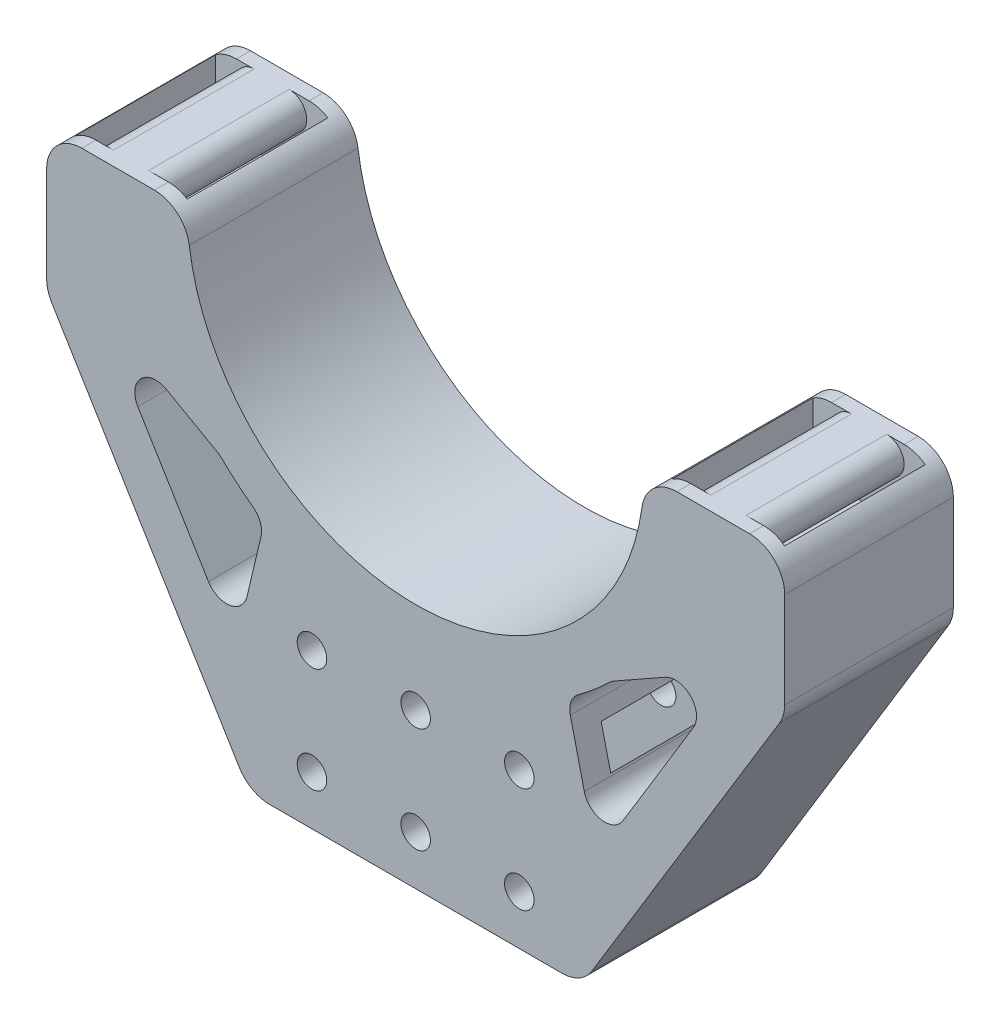
from build123d import *

# Parameters (mm, degrees)
BOSS_EXTRUDE1_DEPTH   = 12.7
BOSS_EXTRUDE1_2_DEPTH = 12.7
BOSS_EXTRUDE1_3_DEPTH = 12.7
BOSS_EXTRUDE3_START   = 15.24
BOSS_EXTRUDE3_DEPTH   = 2.54
BOSS_EXTRUDE4_START   = -12.7
BOSS_EXTRUDE4_DEPTH   = 2.54
FILLET2_R             = 6.35
SKETCH2_W             = 60.761999888
SKETCH2_H             = 20.761999878
CUT_EXTRUDE1_DEPTH    = 38.1
SKETCH3_R             = 2.667
CUT_EXTRUDE2_DEPTH    = 113.791124208
CUT_EXTRUDE3_DEPTH    = 113.791124208
FILLET3_R             = 3.81


with BuildPart() as part:
    # Sketch1 → Boss-Extrude1 (new, symmetric)
    with BuildSketch(Plane.XY):
        with BuildLine():
            ThreePointArc((41.27, 0), (0, -41.27), (-41.27, 0))
            Line((-41.27, 0), (-43.81, 0))
            Line((-43.81, 0), (-43.81, -9.650754782))
            ThreePointArc((-43.81, -9.650754782), (-46.984221818, -11.904467031), (-50.795, -12.7))
            Line((-50.795, -12.7), (-57.145, -12.7))
            ThreePointArc((-57.145, -12.7), (-60.955778182, -11.904467031), (-64.13, -9.650754782))
            Line((-64.13, -9.650754782), (-64.13, 0))
            Line((-64.13, 0), (-66.67, 0))
            Line((-66.67, 0), (-66.67, -25.4))
            Line((-66.67, -25.4), (-30, -85.72))
            Line((-30, -85.72), (30, -85.72))
            Line((30, -85.72), (66.67, -25.4))
            Line((66.67, -25.4), (66.67, 0))
            Line((66.67, 0), (64.13, 0))
            Line((64.13, 0), (64.13, -9.650754782))
            ThreePointArc((64.13, -9.650754782), (60.955778182, -11.904467031), (57.145, -12.7))
            Line((57.145, -12.7), (50.795, -12.7))
            ThreePointArc((50.795, -12.7), (46.984221818, -11.904467031), (43.81, -9.650754782))
            Line((43.81, -9.650754782), (43.81, 0))
            Line((43.81, 0), (41.27, 0))
        make_face()
    extrude(amount=BOSS_EXTRUDE1_DEPTH, both=True)



with BuildPart() as body_2:
    # Sketch1 → Boss-Extrude1 2 (new, symmetric)
    with BuildSketch(Plane.XY):
        with BuildLine():
            ThreePointArc((-50.795, -6.35), (-47.62, -3.175), (-50.795, 0))
            Line((-50.795, 0), (-57.145, 0))
            ThreePointArc((-57.145, 0), (-60.32, -3.175), (-57.145, -6.35))
            Line((-57.145, -6.35), (-50.795, -6.35))
        make_face()
    extrude(amount=BOSS_EXTRUDE1_2_DEPTH, both=True)


with BuildPart() as body_3:
    # Sketch1 → Boss-Extrude1 3 (new, symmetric)
    with BuildSketch(Plane.XY):
        with BuildLine():
            Line((57.145, 0), (50.795, 0))
            ThreePointArc((50.795, 0), (47.62, -3.175), (50.795, -6.35))
            Line((50.795, -6.35), (57.145, -6.35))
            ThreePointArc((57.145, -6.35), (60.32, -3.175), (57.145, 0))
        make_face()
    extrude(amount=BOSS_EXTRUDE1_3_DEPTH, both=True)


with BuildPart() as part_1:
    add(part.part)

    add(body_2.part)  # Boss-Extrude3 merges body 2

    add(body_3.part)  # Boss-Extrude3 merges body 3
    # Sketch1<3> → Boss-Extrude3 (add)
    with BuildSketch(Plane.XY.offset(BOSS_EXTRUDE3_START)):
        with BuildLine():
            ThreePointArc((41.27, 0), (0, -41.27), (-41.27, 0))
            Line((-41.27, 0), (-43.81, 0))
            Line((-43.81, 0), (-43.81, -9.650754782))
            ThreePointArc((-43.81, -9.650754782), (-46.984221818, -11.904467031), (-50.795, -12.7))
            Line((-50.795, -12.7), (-57.145, -12.7))
            ThreePointArc((-57.145, -12.7), (-60.955778182, -11.904467031), (-64.13, -9.650754782))
            Line((-64.13, -9.650754782), (-64.13, 0))
            Line((-64.13, 0), (-66.67, 0))
            Line((-66.67, 0), (-66.67, -25.4))
            Line((-66.67, -25.4), (-30, -85.72))
            Line((-30, -85.72), (30, -85.72))
            Line((30, -85.72), (66.67, -25.4))
            Line((66.67, -25.4), (66.67, 0))
            Line((66.67, 0), (64.13, 0))
            Line((64.13, 0), (64.13, -9.650754782))
            ThreePointArc((64.13, -9.650754782), (60.955778182, -11.904467031), (57.145, -12.7))
            Line((57.145, -12.7), (50.795, -12.7))
            ThreePointArc((50.795, -12.7), (46.984221818, -11.904467031), (43.81, -9.650754782))
            Line((43.81, -9.650754782), (43.81, 0))
            Line((43.81, 0), (41.27, 0))
        make_face()
        with BuildLine():
            Line((-43.81, -9.650754782), (-43.81, 0))
            Line((-43.81, 0), (-50.795, 0))
            ThreePointArc((-50.795, 0), (-47.62, -3.175), (-50.795, -6.35))
            Line((-50.795, -6.35), (-57.145, -6.35))
            ThreePointArc((-57.145, -6.35), (-60.32, -3.175), (-57.145, 0))
            Line((-57.145, 0), (-64.13, 0))
            Line((-64.13, 0), (-64.13, -9.650754782))
            ThreePointArc((-64.13, -9.650754782), (-60.955778182, -11.904467031), (-57.145, -12.7))
            Line((-57.145, -12.7), (-50.795, -12.7))
            ThreePointArc((-50.795, -12.7), (-46.984221818, -11.904467031), (-43.81, -9.650754782))
        make_face()
        with BuildLine():
            ThreePointArc((-50.795, -6.35), (-47.62, -3.175), (-50.795, 0))
            Line((-50.795, 0), (-57.145, 0))
            ThreePointArc((-57.145, 0), (-60.32, -3.175), (-57.145, -6.35))
            Line((-57.145, -6.35), (-50.795, -6.35))
        make_face()
        with BuildLine():
            Line((50.795, 0), (43.81, 0))
            Line((43.81, 0), (43.81, -9.650754782))
            ThreePointArc((43.81, -9.650754782), (46.984221818, -11.904467031), (50.795, -12.7))
            Line((50.795, -12.7), (57.145, -12.7))
            ThreePointArc((57.145, -12.7), (60.955778182, -11.904467031), (64.13, -9.650754782))
            Line((64.13, -9.650754782), (64.13, 0))
            Line((64.13, 0), (57.145, 0))
            ThreePointArc((57.145, 0), (60.32, -3.175), (57.145, -6.35))
            Line((57.145, -6.35), (50.795, -6.35))
            ThreePointArc((50.795, -6.35), (47.62, -3.175), (50.795, 0))
        make_face()
        with BuildLine():
            Line((57.145, 0), (50.795, 0))
            ThreePointArc((50.795, 0), (47.62, -3.175), (50.795, -6.35))
            Line((50.795, -6.35), (57.145, -6.35))
            ThreePointArc((57.145, -6.35), (60.32, -3.175), (57.145, 0))
        make_face()
    extrude(amount=-BOSS_EXTRUDE3_DEPTH)

    # Sketch1<4> → Boss-Extrude4 (add)
    with BuildSketch(Plane.XY.offset(BOSS_EXTRUDE4_START)):
        with BuildLine():
            ThreePointArc((-50.795, -6.35), (-47.62, -3.175), (-50.795, 0))
            Line((-50.795, 0), (-57.145, 0))
            ThreePointArc((-57.145, 0), (-60.32, -3.175), (-57.145, -6.35))
            Line((-57.145, -6.35), (-50.795, -6.35))
        make_face()
        with BuildLine():
            Line((-43.81, -9.650754782), (-43.81, 0))
            Line((-43.81, 0), (-50.795, 0))
            ThreePointArc((-50.795, 0), (-47.62, -3.175), (-50.795, -6.35))
            Line((-50.795, -6.35), (-57.145, -6.35))
            ThreePointArc((-57.145, -6.35), (-60.32, -3.175), (-57.145, 0))
            Line((-57.145, 0), (-64.13, 0))
            Line((-64.13, 0), (-64.13, -9.650754782))
            ThreePointArc((-64.13, -9.650754782), (-60.955778182, -11.904467031), (-57.145, -12.7))
            Line((-57.145, -12.7), (-50.795, -12.7))
            ThreePointArc((-50.795, -12.7), (-46.984221818, -11.904467031), (-43.81, -9.650754782))
        make_face()
        with BuildLine():
            ThreePointArc((41.27, 0), (0, -41.27), (-41.27, 0))
            Line((-41.27, 0), (-43.81, 0))
            Line((-43.81, 0), (-43.81, -9.650754782))
            ThreePointArc((-43.81, -9.650754782), (-46.984221818, -11.904467031), (-50.795, -12.7))
            Line((-50.795, -12.7), (-57.145, -12.7))
            ThreePointArc((-57.145, -12.7), (-60.955778182, -11.904467031), (-64.13, -9.650754782))
            Line((-64.13, -9.650754782), (-64.13, 0))
            Line((-64.13, 0), (-66.67, 0))
            Line((-66.67, 0), (-66.67, -25.4))
            Line((-66.67, -25.4), (-30, -85.72))
            Line((-30, -85.72), (30, -85.72))
            Line((30, -85.72), (66.67, -25.4))
            Line((66.67, -25.4), (66.67, 0))
            Line((66.67, 0), (64.13, 0))
            Line((64.13, 0), (64.13, -9.650754782))
            ThreePointArc((64.13, -9.650754782), (60.955778182, -11.904467031), (57.145, -12.7))
            Line((57.145, -12.7), (50.795, -12.7))
            ThreePointArc((50.795, -12.7), (46.984221818, -11.904467031), (43.81, -9.650754782))
            Line((43.81, -9.650754782), (43.81, 0))
            Line((43.81, 0), (41.27, 0))
        make_face()
        with BuildLine():
            Line((57.145, 0), (50.795, 0))
            ThreePointArc((50.795, 0), (47.62, -3.175), (50.795, -6.35))
            Line((50.795, -6.35), (57.145, -6.35))
            ThreePointArc((57.145, -6.35), (60.32, -3.175), (57.145, 0))
        make_face()
        with BuildLine():
            Line((50.795, 0), (43.81, 0))
            Line((43.81, 0), (43.81, -9.650754782))
            ThreePointArc((43.81, -9.650754782), (46.984221818, -11.904467031), (50.795, -12.7))
            Line((50.795, -12.7), (57.145, -12.7))
            ThreePointArc((57.145, -12.7), (60.955778182, -11.904467031), (64.13, -9.650754782))
            Line((64.13, -9.650754782), (64.13, 0))
            Line((64.13, 0), (57.145, 0))
            ThreePointArc((57.145, 0), (60.32, -3.175), (57.145, -6.35))
            Line((57.145, -6.35), (50.795, -6.35))
            ThreePointArc((50.795, -6.35), (47.62, -3.175), (50.795, 0))
        make_face()
    extrude(amount=-BOSS_EXTRUDE4_DEPTH)

    # Fillet2
    # the kernel refuses this fillet: 6.35 mm, written as the material it takes off along each edge
    with BuildSketch(Plane(origin=(-66.67, 0, -31.115), x_dir=(1, 0, 0), z_dir=(0, 0, 1))) as fillet2_piece_1:
        with BuildLine():
            CenterArc((FILLET2_R, -FILLET2_R), FILLET2_R, 90, 90)
            Line((0, -FILLET2_R), (0, 0))
            Line((0, 0), (FILLET2_R, 0))
        make_face()
    extrude(amount=62.23, mode=Mode.SUBTRACT)
    with BuildSketch(Plane(origin=(-41.27, 0, -30.051808055), x_dir=(0.06682302644144887, -0.9977648436065512, 0), z_dir=(0, 0, 1)), Plane(origin=(41.27, 0, 30.051808055), x_dir=(-0.06682302644145022, -0.9977648436065509, 0), z_dir=(0, 0, -1))) as fillet2_piece_2:
        with BuildLine():
            CenterArc((5.93989882, -6.335806757), FILLET2_R, 93.831532506, 82.336934987)
            Line((-0.395907937, -5.911480539), (0, 0))
            ThreePointArc((0, 0), (2.757786301, -0.092244904), (5.515572602, 0))
        make_face()
    extrude(amount=60.10361611, mode=Mode.SUBTRACT)
    with BuildSketch(Plane(origin=(66.67, 0, 31.115), x_dir=(0, -1, 0), z_dir=(0, 0, -1))) as fillet2_piece_3:
        with BuildLine():
            CenterArc((FILLET2_R, FILLET2_R), FILLET2_R, 180, 90)
            Line((0, FILLET2_R), (0, 0))
            Line((0, 0), (FILLET2_R, 0))
        make_face()
    extrude(amount=62.23, mode=Mode.SUBTRACT)
    with BuildSketch(Plane(origin=(66.67, -25.4, -19.686784737), x_dir=(-0.5194660032089745, -0.8544911184500947, 0), z_dir=(0, 0, 1)), Plane(origin=(-66.67, -25.4, -19.686784737), x_dir=(0, 1, 0), z_dir=(0, 0, 1))) as fillet2_piece_4:
        with BuildLine():
            CenterArc((FILLET2_R * 0.280112424395, -FILLET2_R), FILLET2_R, 90, 31.296438863)
            Line((-FILLET2_R * 0.239353578813, -FILLET2_R * 0.14550888155), (0, 0))
            Line((0, 0), (FILLET2_R * 0.280112424395, 0))
        make_face()
    extrude(amount=39.373569475, mode=Mode.SUBTRACT)
    with BuildSketch(Plane(origin=(30, -85.72, -24.167509057), x_dir=(-1, 0, 0), z_dir=(0, 0, 1)), Plane(origin=(-30, -85.72, -24.167509057), x_dir=(-0.51946600320897, 0.8544911184500974, 0), z_dir=(0, 0, 1))) as fillet2_piece_5:
        with BuildLine():
            CenterArc((FILLET2_R * 0.562362775242, -FILLET2_R), FILLET2_R, 90, 58.703561137)
            Line((-FILLET2_R * 0.292128343208, -FILLET2_R * 0.480533996791), (0, 0))
            Line((0, 0), (FILLET2_R * 0.562362775242, 0))
        make_face()
    extrude(amount=48.335018114, mode=Mode.SUBTRACT)

    # Sketch2 → Cut-Extrude1 (cut)
    with BuildSketch(Plane.XZ.offset(85.72)):
        Rectangle(SKETCH2_W, SKETCH2_H)
    extrude(amount=-CUT_EXTRUDE1_DEPTH, mode=Mode.SUBTRACT)

    # Sketch3 → Cut-Extrude2 (cut, through all)
    with BuildSketch(Plane.XY.offset(15.24)):
        with Locations((0, -57.78)):
            Circle(SKETCH3_R)
        with Locations((0, -76.83)):
            Circle(SKETCH3_R)
        with Locations((-18.7325, -57.78)):
            Circle(SKETCH3_R)
        with Locations((18.7325, -57.78)):
            Circle(SKETCH3_R)
        with Locations((-18.7325, -76.83)):
            Circle(SKETCH3_R)
        with Locations((18.7325, -76.83)):
            Circle(SKETCH3_R)
    extrude(amount=-CUT_EXTRUDE2_DEPTH, mode=Mode.SUBTRACT)

    # Sketch4 → Cut-Extrude3 (cut, through all)
    with BuildSketch(Plane.XY.offset(15.24)):
        with BuildLine():
            Line((57.78, -22.909800547), (32.620594928, -64.295546768))
            Line((32.620594928, -64.295546768), (27.340783065, -42.053622691))
            ThreePointArc((27.340783065, -42.053622691), (31.526384833, -39.014262255), (35.376715506, -35.56))
            Line((35.376715506, -35.56), (57.78, -22.909800547))
        make_face()
        with BuildLine():
            Line((-57.78, -22.909800547), (-35.376715506, -35.56))
            ThreePointArc((-35.376715506, -35.56), (-31.526384833, -39.014262255), (-27.340783065, -42.053622691))
            Line((-27.340783065, -42.053622691), (-32.620594928, -64.295546768))
            Line((-32.620594928, -64.295546768), (-57.78, -22.909800547))
        make_face()
    extrude(amount=-CUT_EXTRUDE3_DEPTH, mode=Mode.SUBTRACT)

    # Fillet3
    fillet3_edges = [part_1.edges().sort_by_distance(p)[0] for p in [
        (-27.340783065, -42.053622691, 0),
        (-35.376715506, -35.56, 0),
        (-32.620594928, -64.295546768, 0),
        (-57.78, -22.909800547, 0),
        (32.620594928, -64.295546768, 0),
        (27.340783065, -42.053622691, 0),
        (35.376715506, -35.56, 0),
        (57.78, -22.909800547, 0),
    ]]
    fillet(fillet3_edges, radius=FILLET3_R)


solid = part_1.part
